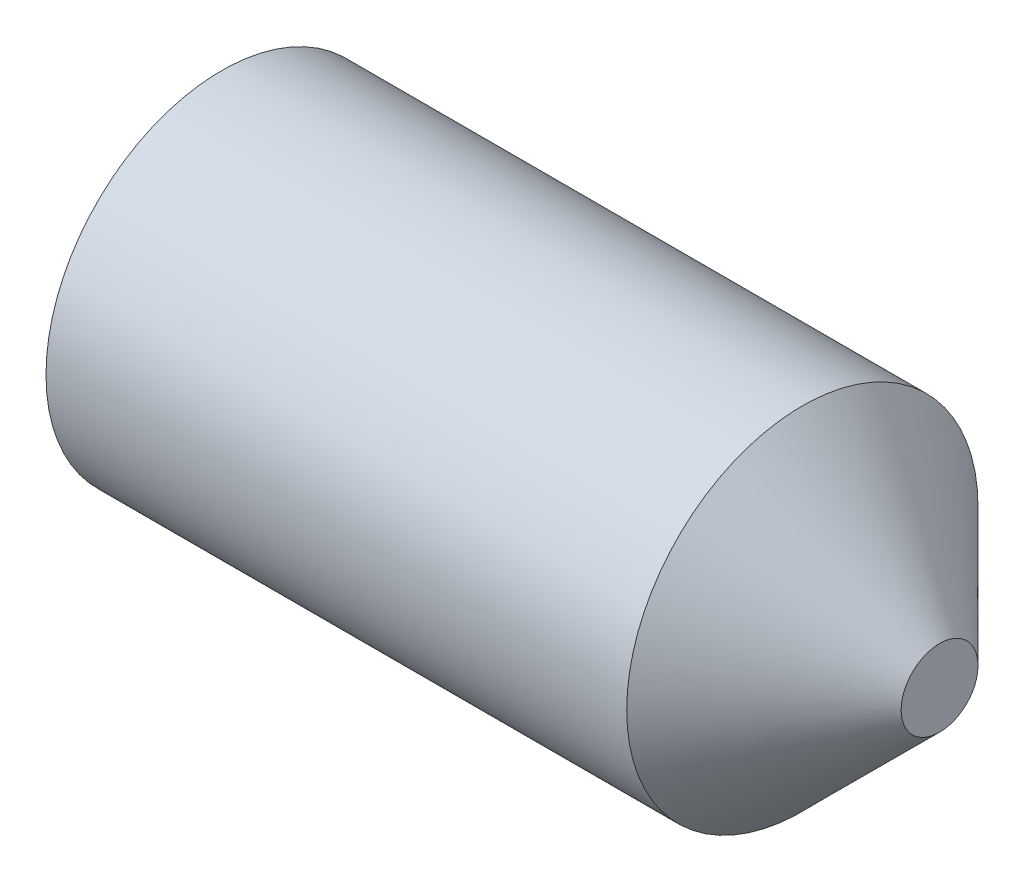
from build123d import *

# Parameters (mm, degrees)
HEX_2_DEPTH = 15


with BuildPart() as part:
    # BodySke → BaseBody (revolve)
    with BuildSketch(Plane.XY):
        Polygon((0, 0), (0, 10.352), (0.951473244, 12), (40.625, 12), (50, 2.625), (50, 0), align=None)
    revolve(axis=Axis((-12.7, 0, 0), (1, 0, 0)))

    # Sketch2 → Hex 2 (cut)
    with BuildSketch(Plane.ZY):
        Polygon((3.464101615, 6), (-3.464101615, 6), (-6.92820323, 0), (-3.464101615, -6), (3.464101615, -6), (6.92820323, 0), align=None)
    extrude(amount=-HEX_2_DEPTH, mode=Mode.SUBTRACT)


solid = part.part
